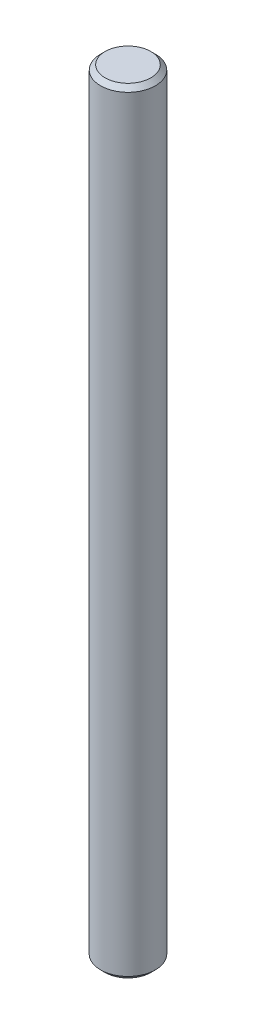
from build123d import *

# Parameters (mm, degrees)
SKETCH1_R           = 3
BOSS_EXTRUDE1_DEPTH = 84.75
CHAMFER1_SIZE       = 0.5


with BuildPart() as part:
    # Sketch1 → Boss-Extrude1 (new body)
    with BuildSketch(Plane(origin=(0, 0, 0), x_dir=(1, 0, 0), z_dir=(0, 1, 0))):
        Circle(SKETCH1_R)
    extrude(amount=BOSS_EXTRUDE1_DEPTH)

    # Chamfer1
    chamfer1_edges = [part.edges().sort_by_distance(p)[0] for p in [
        (-3, 0, 0),
        (-3, 84.75, 0),
    ]]
    chamfer(chamfer1_edges, length=CHAMFER1_SIZE)


solid = part.part
